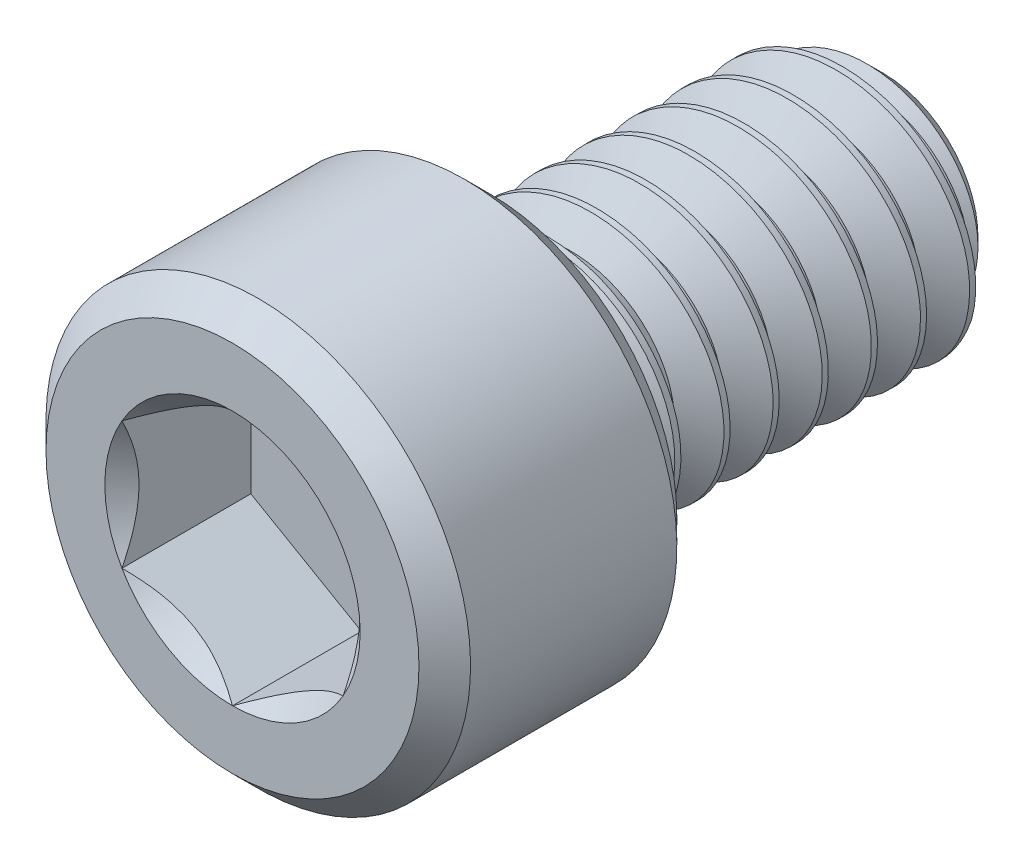
from build123d import *

# Parameters (mm, degrees)
CUT_EXTRUDE1_DEPTH = 2.0828
CUT_SWEEP1_PITCH   = 0.79375
CUT_SWEEP1_TO      = 6.35


with BuildPart() as part:
    # Sketch3 → Revolve1 (revolve)
    with BuildSketch(Plane(origin=(0, 0, 0), x_dir=(0, 0, -1), z_dir=(1, 0, 0))):
        Polygon((5.2578, 0), (-5.2578, 0), (-5.2578, 3.01244), (-4.84124, 3.429), (-1.50876, 3.429), (-1.0922, 3.01244), (-1.0922, 2.0828), (4.702175, 2.0828), (5.2578, 1.527175), align=None)
    revolve(axis=Axis((0, 0, -5.2578), (0, 0, 1)))

    # Sketch4 → Cut-Extrude1 (cut)
    with BuildSketch(Plane.XY.offset(5.2578)):
        Polygon((0, -2.062222993), (1.7859375, -1.031111496), (1.7859375, 1.031111496), (0, 2.062222993), (-1.7859375, 1.031111496), (-1.7859375, -1.031111496), align=None)
    extrude(amount=-CUT_EXTRUDE1_DEPTH, mode=Mode.SUBTRACT)

    # Cut-Extrude3 cone 1 section (through the dimple's axis) → Cut-Extrude3 (revolve, cut)
    with BuildSketch(Plane(origin=(0, 0, 5.2578), x_dir=(0, -1, 0), z_dir=(1, 0, 0))):
        Polygon((0, 0), (2.062222993, 0), (0, 2.062222993), align=None)
    revolve(axis=Axis((0, 0, 5.2578), (0, 0, -1)), mode=Mode.SUBTRACT)


with BuildPart() as body_2:
    # Split1: read off the stored shape, not the designer's step
    # Split1: the piece on the far side of the plane
    add(part.part)
    split(bisect_by=Plane.XY.offset(1.0922), keep=Keep.BOTTOM)

    # Cut-Sweep1: arcs per turn and ends read off the stored shape
    # Cut-Sweep1: the profile of Sketch7 screwed along a right-hand helix through 9 turns, 8 arcs to a turn; built about Z, then put on its axis
    cut_sweep1_z = Axis((0, 0, 0), (0, 0, 1))
    cut_sweep1_corners = [(2.125762979, 0, 0.024804687), (2.125762979, 0, -0.719335938), (1.567244252, 0, -0.396875), (1.567244252, 0, -0.29765625)]
    with BuildLine(mode=Mode.PRIVATE) as cut_sweep1_profile:
        Line(cut_sweep1_corners[0], cut_sweep1_corners[1])
        Line(cut_sweep1_corners[1], cut_sweep1_corners[2])
        Line(cut_sweep1_corners[2], cut_sweep1_corners[3])
        Line(cut_sweep1_corners[3], cut_sweep1_corners[0])
    cut_sweep1_cap = Face(cut_sweep1_profile.wire())
    cut_sweep1_turn_angles = [0, 22.5, 45, 67.5, 90, 112.5, 135, 157.5, 180, 202.5, 225, 247.5, 270, 292.5, 315, 337.5, 360]
    cut_sweep1_turn_weights = [1, 0.9238795325112867, 1, 0.9238795325112867, 1, 0.9238795325112867, 1, 0.9238795325112867, 1, 0.9238795325112867, 1, 0.9238795325112867, 1, 0.9238795325112867, 1, 0.9238795325112867, 1]
    cut_sweep1_turn_rails = [Edge.make_bspline([Vector(p[0], p[1], 0).rotate(cut_sweep1_z, cut_sweep1_turn_angles[k]) / cut_sweep1_turn_weights[k] + Vector(0, 0, p[2] + CUT_SWEEP1_PITCH * cut_sweep1_turn_angles[k] / 360) for k in range(17)], [0, 0, 0, 1, 1, 2, 2, 3, 3, 4, 4, 5, 5, 6, 6, 7, 7, 8, 8, 8], 2, cut_sweep1_turn_weights) for p in cut_sweep1_corners]
    cut_sweep1_turn_sides = [Face.make_surface_from_curves(cut_sweep1_turn_rails[p[0]], cut_sweep1_turn_rails[p[1]]) for p in [(0, 1), (1, 2), (2, 3), (3, 0)]]
    cut_sweep1 = Plane(origin=(0, 0, -5.2578), x_dir=(0, 1, 0), z_dir=(0, 0, 1)) * split(Solid(Shell([*[p.moved(Location((0, 0, CUT_SWEEP1_PITCH * i))) for i in range(9) for p in cut_sweep1_turn_sides], cut_sweep1_cap, cut_sweep1_cap.rotate(cut_sweep1_z, 3240).moved(Location((0, 0, CUT_SWEEP1_PITCH * 3240 / 360)))])), bisect_by=Plane.XY.offset(CUT_SWEEP1_TO), keep=Keep.BOTTOM, mode=Mode.PRIVATE)
    add(cut_sweep1, mode=Mode.SUBTRACT)


with BuildPart() as part_1:
    add(part.part)

    # Split1
    split(bisect_by=Plane.XY.offset(1.0922), keep=Keep.TOP)

    add(body_2.part)  # Boss-Extrude1 merges body 2
    # Boss-Extrude1: read off the stored shape, not the designer's step
    # Boss-Extrude1 outline → Boss-Extrude1 (revolve)
    with BuildSketch(Plane.XZ):
        Polygon((1.567243236, 1.0922), (1.567243236, -0.324280567), (2.0828, 1.0922), align=None)
    revolve(axis=Axis((0, 0, 0), (0, 0, 1)))


solid = part_1.part
